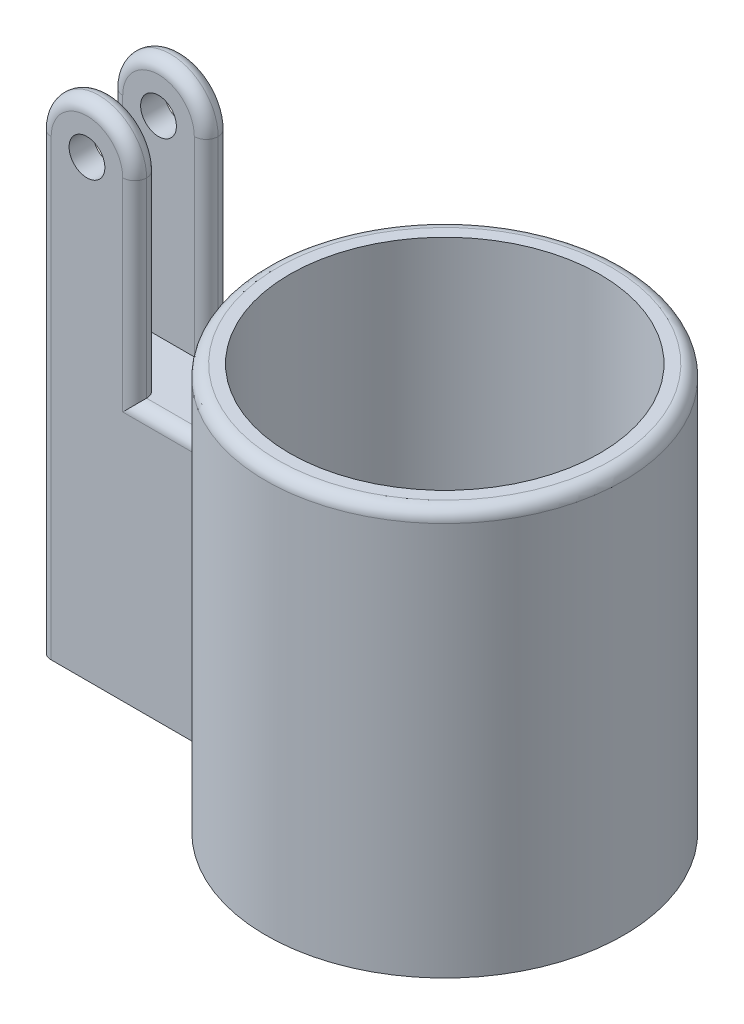
from build123d import *

# Parameters (mm, degrees)
SKETCH1_R                = 7.5
SKETCH1_R_2              = 6.5
BOSS_EXTRUDE2_DEPTH      = 20
SKETCH1_W                = 4
SKETCH1_H                = 1
BOSS_EXTRUDE2_2_DEPTH    = 20
BOSS_EXTRUDE2_3_DEPTH    = 20
BOSS_EXTRUDE3_START      = 1
BOSS_EXTRUDE3_DEPTH      = 1
SKETCH5_W                = 4
SKETCH5_H                = 2
BOSS_EXTRUDE4_DEPTH      = 10
CUT_EXTRUDE5_START       = 16
CUT_EXTRUDE5_OUTLINE_R   = 7.5
CUT_EXTRUDE5_OUTLINE_R_2 = 6.5
CUT_EXTRUDE5_DEPTH       = 4
CUT_EXTRUDE6_DEPTH       = 20
FILLET1_R                = 0.5
FILLET2_R                = 0.5


# Read off the part's stored shape, not the designer's step: Cut-Extrude5
with BuildPart() as part:
    # Sketch1 → Boss-Extrude2 (new body)
    with BuildSketch(Plane(origin=(0, 0, 0), x_dir=(1, 0, 0), z_dir=(0, 1, 0))):
        with Locations(Location((0, 0, 0), (0, 0, 270))):
            Circle(SKETCH1_R)
        with Locations(Location((0, 0, 0), (0, 0, 270))):
            Circle(SKETCH1_R_2, mode=Mode.SUBTRACT)
    extrude(amount=BOSS_EXTRUDE2_DEPTH)



with BuildPart() as body_2:
    # Sketch1 → Boss-Extrude2 2 (new body)
    with BuildSketch(Plane(origin=(0, 0, 0), x_dir=(1, 0, 0), z_dir=(0, 1, 0))):
        with Locations((-13, 1.5)):
            Rectangle(SKETCH1_W, SKETCH1_H)
    extrude(amount=BOSS_EXTRUDE2_2_DEPTH)


with BuildPart() as body_3:
    # Sketch1 → Boss-Extrude2 3 (new body)
    with BuildSketch(Plane(origin=(0, 0, 0), x_dir=(1, 0, 0), z_dir=(0, 1, 0))):
        with Locations((-13, -1.5)):
            Rectangle(SKETCH1_W, SKETCH1_H)
    extrude(amount=BOSS_EXTRUDE2_3_DEPTH)


with BuildPart() as part_1:
    add(part.part)

    add(body_2.part)  # Boss-Extrude3 merges body 2

    add(body_3.part)  # Boss-Extrude3 merges body 3
    # Sketch3 → Boss-Extrude3 (add)
    with BuildSketch(Plane(origin=(0, 0, 0), x_dir=(-1, 0, 0), z_dir=(0, -1, 0)).offset(BOSS_EXTRUDE3_START)):
        with BuildLine():
            Line((15, -2), (7.228416147, -2))
            ThreePointArc((7.228416147, -2), (-7.499972324, 0.020374901), (7.239176027, 1.96069642))
            Line((7.239176027, 1.96069642), (15, 1.96069642))
            Line((15, 1.96069642), (15, -2))
        make_face()
    extrude(amount=-BOSS_EXTRUDE3_DEPTH)

    # Sketch5 → Boss-Extrude4 (add)
    with BuildSketch(Plane(origin=(0, 0, 0), x_dir=(1, 0, 0), z_dir=(0, 1, 0))):
        with BuildLine():
            Line((-11, 1), (-11, -1))
            Line((-11, -1), (-11, -2))
            Line((-11, -2), (-7.228416147, -2))
            ThreePointArc((-7.228416147, -2), (-7.499972324, -0.020374901), (-7.239176027, 1.96069642))
            Line((-7.239176027, 1.96069642), (-11, 1.96069642))
            Line((-11, 1.96069642), (-11, 1))
        make_face()
        with Locations((-13, 0)):
            Rectangle(SKETCH5_W, SKETCH5_H)
    extrude(amount=BOSS_EXTRUDE4_DEPTH)


with BuildPart() as boss_extrude4_kept_piece:
    # of the separate pieces the step leaves, the one the design keeps (boss_extrude4_pieces_kept)
    add(part_1.part.solids().sort_by_distance((0, 0, 7.5))[0])

    # Cut-Extrude5 outline → Cut-Extrude5 (cut)
    with BuildSketch(Plane(origin=(0, 0, 0), x_dir=(1, 0, 0), z_dir=(0, 1, 0)).offset(CUT_EXTRUDE5_START)):
        Circle(CUT_EXTRUDE5_OUTLINE_R)
        Circle(CUT_EXTRUDE5_OUTLINE_R_2, mode=Mode.SUBTRACT)
    extrude(amount=CUT_EXTRUDE5_DEPTH, mode=Mode.SUBTRACT)

    # Sketch7 → Cut-Extrude6 (cut)
    with BuildSketch(Plane.XY.offset(2)):
        with BuildLine():
            ThreePointArc((-12.25, 18), (-13, 18.75), (-13.75, 18))
            Line((-13.75, 18), (-12.25, 18))
        make_face()
        with BuildLine():
            Line((-12.25, 18), (-13.75, 18))
            ThreePointArc((-13.75, 18), (-13, 17.25), (-12.25, 18))
        make_face()
        with BuildLine():
            Line((-11, 20), (-13, 20))
            ThreePointArc((-13, 20), (-11.585786438, 19.414213562), (-11, 18))
            Line((-11, 18), (-11, 20))
        make_face()
        with BuildLine():
            Line((-13, 20), (-15, 20))
            Line((-15, 20), (-15, 18))
            ThreePointArc((-15, 18), (-14.414213562, 19.414213562), (-13, 20))
        make_face()
    extrude(amount=-CUT_EXTRUDE6_DEPTH, mode=Mode.SUBTRACT)

    # Fillet1
    fillet1_edges = [boss_extrude4_kept_piece.edges().sort_by_distance(p)[0] for p in [
        (-15, 9, -2),
        (-11, 9, -2),
        (-15, 14, -1),
        (-11, 14, -1),
        (-11, 14, 1),
        (-15, 14, 1),
        (-11, 14, 2),
        (-15, 8.5, 2),
        (0, 16, -7.5),
        (-13, 20, -2),
        (-13, 20, -1),
        (-13, 20, 1),
        (-13, 20, 2),
    ]]
    fillet(fillet1_edges, radius=FILLET1_R - 0.0001)  # a hair under: the kernel refuses the full size

    # Fillet2
    fillet2_edges = [boss_extrude4_kept_piece.edges().sort_by_distance(p)[0] for p in [
        (-9.272389998, 10, -1.96069642),
        (-15, 10, 0),
        (-9.364158074, 10, 2),
    ]]
    fillet(fillet2_edges, radius=FILLET2_R - 0.0001)  # a hair under: the kernel refuses the full size


solid = boss_extrude4_kept_piece.part
